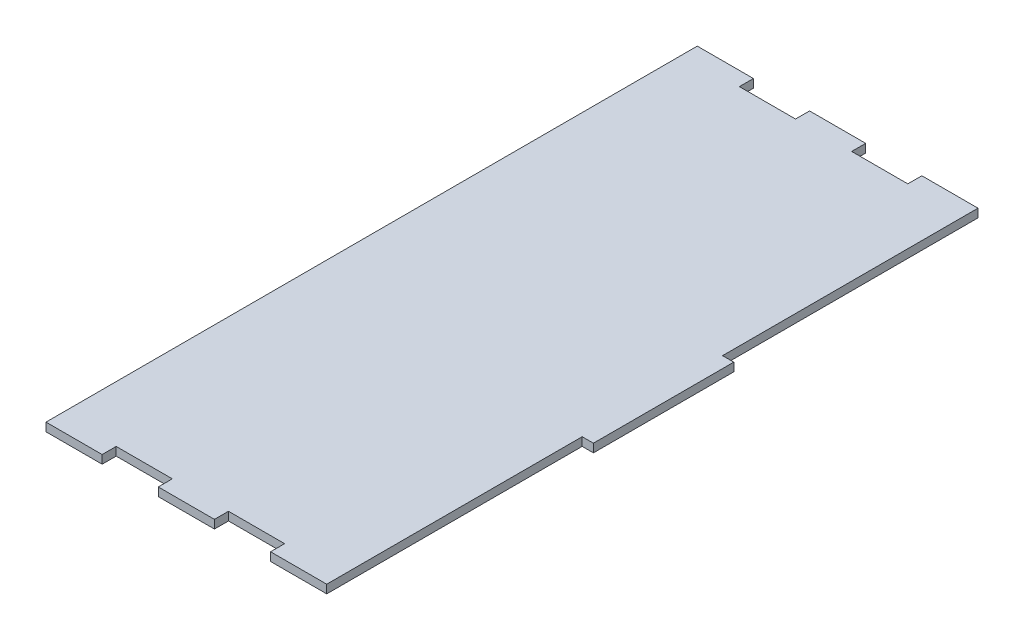
from build123d import *

# Parameters (mm, degrees)
BOSS_EXTRUDE1_DEPTH = 3


with BuildPart() as part:
    # Sketch1 → Boss-Extrude1 (new body)
    with BuildSketch(Plane(origin=(0, 0, 0), x_dir=(1, 0, 0), z_dir=(0, 1, 0))):
        Polygon((-50, -111), (-50, -116), (-30, -116), (-30, -111), (-10, -111), (-10, -116), (10, -116), (10, -111), (30, -111), (30, -116), (50, -116), (50, -111), (50, -25), (54, -25), (54, 25), (50, 25), (50, 111), (50, 116), (30, 116), (30, 111), (10, 111), (10, 116), (-10, 116), (-10, 111), (-30, 111), (-30, 116), (-50, 116), (-50, 111), align=None)
    extrude(amount=BOSS_EXTRUDE1_DEPTH)


solid = part.part
